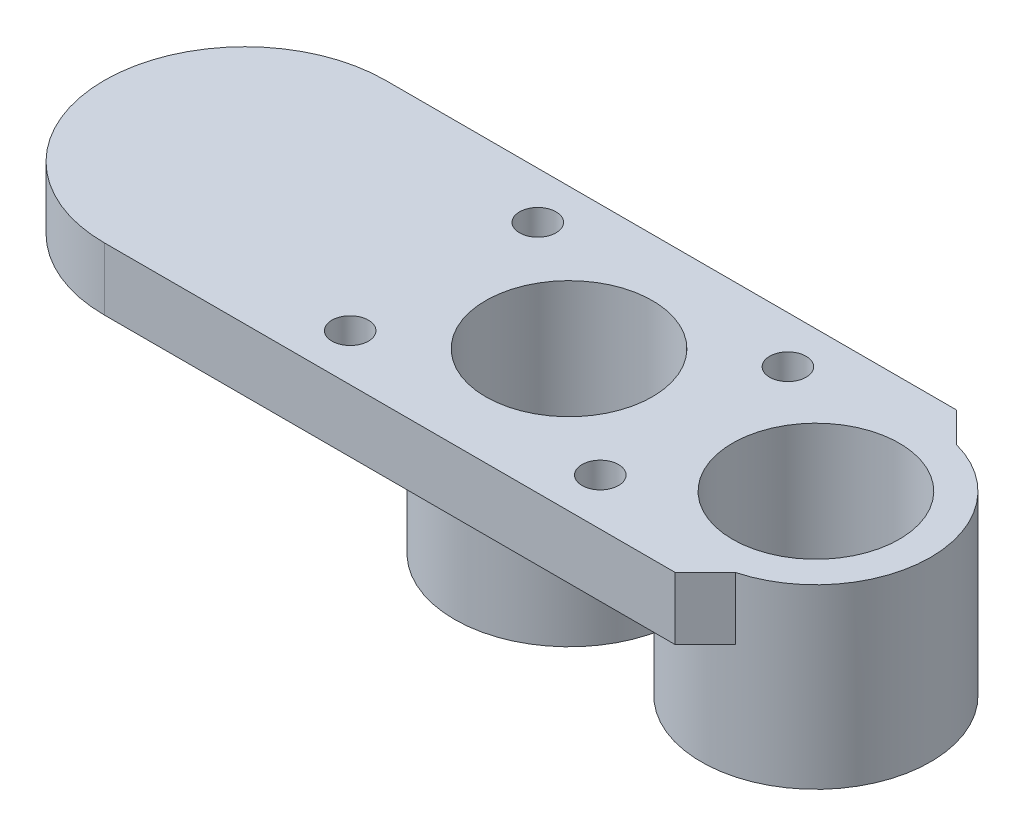
from build123d import *

# Parameters (mm, degrees)
SKETCH1_R               = 1.75
SKETCH1_R_2             = 5
BOSS_EXTRUDE1_DEPTH     = 6
SKETCH2_R               = 3
SKETCH2_R_2             = 1.75
CUT_EXTRUDE1_DEPTH      = 3
CUT_EXTRUDE2_START      = -3
SKETCH3_R               = 8
SKETCH3_R_2             = 5
CUT_EXTRUDE2_DEPTH      = 3
SKETCH5_R               = 13.5
BOSS_EXTRUDE2_DEPTH     = 6
CUT_EXTRUDE3_DEPTH      = 47.983082062
CUT_EXTRUDE3_DEPTH_BACK = 47.983082062
SKETCH6_R               = 8
BOSS_EXTRUDE6_START     = -8
SKETCH9_R               = 11
SKETCH9_R_2             = 8
BOSS_EXTRUDE6_DEPTH     = 8
BOSS_EXTRUDE7_START     = 3
SKETCH10_R              = 11
SKETCH10_R_2            = 5
BOSS_EXTRUDE7_DEPTH     = 3
CHAMFER3_SIZE           = 2.5


with BuildPart() as part:
    # Sketch1 → Boss-Extrude1 (new body)
    with BuildSketch(Plane(origin=(0, 0, 0), x_dir=(1, 0, 0), z_dir=(0, 1, 0))):
        with BuildLine():
            Line((23.69, 13.5), (-31.1, 13.5))
            Line((-31.1, 13.5), (-31.1, 10.5))
            ThreePointArc((-31.1, 10.5), (-20.6, 0), (-31.1, -10.5))
            Line((-31.1, -10.5), (-31.1, -13.5))
            Line((-31.1, -13.5), (23.69, -13.5))
            Line((23.69, -13.5), (23.69, -11))
            ThreePointArc((23.69, -11), (34.69, 0), (23.69, 11))
            Line((23.69, 11), (23.69, 13.5))
        make_face()
        with Locations(Location((-12, -9, 0), (0, 0, 270))):
            Circle(SKETCH1_R, mode=Mode.SUBTRACT)
        with Locations(Location((12, -9, 0), (0, 0, 270))):
            Circle(SKETCH1_R, mode=Mode.SUBTRACT)
        with Locations(Location((-12, 9, 0), (0, 0, 270))):
            Circle(SKETCH1_R, mode=Mode.SUBTRACT)
        with Locations(Location((0, 0, 0), (0, 0, 270))):
            Circle(SKETCH1_R_2, mode=Mode.SUBTRACT)
        with Locations(Location((12, 9, 0), (0, 0, 270))):
            Circle(SKETCH1_R, mode=Mode.SUBTRACT)
        with Locations(Location((23.69, 0, 0), (0, 0, 270))):
            Circle(SKETCH1_R_2, mode=Mode.SUBTRACT)
    extrude(amount=BOSS_EXTRUDE1_DEPTH)

    # Sketch2 → Cut-Extrude1 (cut)
    # profile 1 of 4: a face of its own
    with BuildSketch(Plane.XZ):
        with Locations(Location((-12, -9, 0), (0, 0, 270))):
            Circle(SKETCH2_R)
        with Locations(Location((-12, -9, 0), (0, 0, 270))):
            Circle(SKETCH2_R_2, mode=Mode.SUBTRACT)
    # profile 2 of 4: a face of its own
    with BuildSketch(Plane.XZ):
        with Locations(Location((-12, 9, 0), (0, 0, 270))):
            Circle(SKETCH2_R)
        with Locations(Location((-12, 9, 0), (0, 0, 270))):
            Circle(SKETCH2_R_2, mode=Mode.SUBTRACT)
    # profile 3 of 4: a face of its own
    with BuildSketch(Plane.XZ):
        with Locations(Location((12, 9, 0), (0, 0, 270))):
            Circle(SKETCH2_R)
        with Locations(Location((12, 9, 0), (0, 0, 270))):
            Circle(SKETCH2_R_2, mode=Mode.SUBTRACT)
    # profile 4 of 4: a face of its own
    with BuildSketch(Plane.XZ):
        with Locations(Location((12, -9, 0), (0, 0, 270))):
            Circle(SKETCH2_R)
        with Locations(Location((12, -9, 0), (0, 0, 270))):
            Circle(SKETCH2_R_2, mode=Mode.SUBTRACT)
    extrude(amount=-CUT_EXTRUDE1_DEPTH, mode=Mode.SUBTRACT)

    # Sketch3 → Cut-Extrude2 (cut)
    # profile 1 of 2: a face of its own
    with BuildSketch(Plane(origin=(0, 6, 0), x_dir=(1, 0, 0), z_dir=(0, 1, 0)).offset(CUT_EXTRUDE2_START)):
        with Locations(Location((0, 0, 0), (0, 0, 270))):
            Circle(SKETCH3_R)
        with Locations(Location((0, 0, 0), (0, 0, 270))):
            Circle(SKETCH3_R_2, mode=Mode.SUBTRACT)
    # profile 2 of 2: a face of its own
    with BuildSketch(Plane(origin=(0, 6, 0), x_dir=(1, 0, 0), z_dir=(0, 1, 0)).offset(CUT_EXTRUDE2_START)):
        with Locations(Location((23.69, 0, 0), (0, 0, 270))):
            Circle(SKETCH3_R)
        with Locations(Location((23.69, 0, 0), (0, 0, 270))):
            Circle(SKETCH3_R_2, mode=Mode.SUBTRACT)
    extrude(amount=CUT_EXTRUDE2_DEPTH, mode=Mode.SUBTRACT)

    # Sketch5 → Boss-Extrude2 (add)
    with BuildSketch(Plane(origin=(0, 0, 0), x_dir=(1, 0, 0), z_dir=(0, 1, 0))):
        with Locations((-31.1, 0)):
            Circle(SKETCH5_R)
    extrude(amount=BOSS_EXTRUDE2_DEPTH)

    # Sketch6 → Cut-Extrude3 (cut, two sides: drawn at the far end of the back side and taken through both)
    with BuildSketch(Plane(origin=(0, 6, 0), x_dir=(1, 0, 0), z_dir=(0, 1, 0)).offset(-CUT_EXTRUDE3_DEPTH_BACK)):
        with Locations(Location((0, 0, 0), (0, 0, 270))):
            Circle(SKETCH6_R)
        with Locations(Location((23.69, 0, 0), (0, 0, 270))):
            Circle(SKETCH6_R)
    extrude(amount=CUT_EXTRUDE3_DEPTH + CUT_EXTRUDE3_DEPTH_BACK, mode=Mode.SUBTRACT)

    # Sketch9 → Boss-Extrude6 (add)
    # profile 1 of 2: a face of its own
    with BuildSketch(Plane(origin=(0, 0, 0), x_dir=(1, 0, 0), z_dir=(0, 1, 0)).offset(BOSS_EXTRUDE6_START)):
        with Locations(Location((0, 0, 0), (0, 0, 270))):
            Circle(SKETCH9_R)
        with Locations(Location((0, 0, 0), (0, 0, 270))):
            Circle(SKETCH9_R_2, mode=Mode.SUBTRACT)
    # profile 2 of 2: a face of its own
    with BuildSketch(Plane(origin=(0, 0, 0), x_dir=(1, 0, 0), z_dir=(0, 1, 0)).offset(BOSS_EXTRUDE6_START)):
        with BuildLine():
            ThreePointArc((23.69, 11), (12.69, 0), (23.69, -11))
            ThreePointArc((23.69, -11), (31.468174593, -7.778174593), (34.69, 0))
            ThreePointArc((34.69, 0), (31.468174593, 7.778174593), (23.69, 11))
        make_face()
        with Locations(Location((23.69, 0, 0), (0, 0, 270))):
            Circle(SKETCH9_R_2, mode=Mode.SUBTRACT)
    extrude(amount=BOSS_EXTRUDE6_DEPTH)

    # Sketch10 → Boss-Extrude7 (add)
    # profile 1 of 2: a face of its own
    with BuildSketch(Plane.XZ.offset(8).offset(BOSS_EXTRUDE7_START)):
        with Locations(Location((23.69, 0, 0), (0, 0, 270))):
            Circle(SKETCH10_R)
        with Locations(Location((23.69, 0, 0), (0, 0, 270))):
            Circle(SKETCH10_R_2, mode=Mode.SUBTRACT)
    # profile 2 of 2: a face of its own
    with BuildSketch(Plane.XZ.offset(8).offset(BOSS_EXTRUDE7_START)):
        with Locations(Location((0, 0, 0), (0, 0, 90))):
            Circle(SKETCH10_R)
        with Locations(Location((0, 0, 0), (0, 0, 270))):
            Circle(SKETCH10_R_2, mode=Mode.SUBTRACT)
    extrude(amount=-BOSS_EXTRUDE7_DEPTH)

    # Chamfer3
    # the kernel refuses this chamfer: 2.5 mm, written as the material it adds along each edge
    with BuildSketch(Plane(origin=(23.69, 0, 11), x_dir=(0.9912092295509808, 0, -0.13230367815352337), z_dir=(0, 1, 0))) as chamfer3_piece_1_section:
        with BuildLine():
            Line((2.910680919, 0), (-CHAMFER3_SIZE * 0.132303678154, -CHAMFER3_SIZE * 0.991209229551))
            Line((-CHAMFER3_SIZE * 0.132303678154, -CHAMFER3_SIZE * 0.991209229551), (0, 0))
            ThreePointArc((0, 0), (1.49552658, -0.096625069), (2.910680919, 0))
        make_face()
    chamfer3_piece_1 = extrude(amount=6, mode=Mode.PRIVATE)
    chamfer3_piece_1 = split(chamfer3_piece_1, bisect_by=Plane(origin=(23.69, 0, 13.5), z_dir=(0, 0, -1)), keep=Keep.TOP, mode=Mode.PRIVATE)
    add(chamfer3_piece_1)
    with BuildSketch(Plane(origin=(23.69, 0, -11), x_dir=(0, 0, -1), z_dir=(0, 1, 0))) as chamfer3_piece_2_section:
        with BuildLine():
            Line((CHAMFER3_SIZE, 0), (-0.385093792, -2.885093792))
            ThreePointArc((-0.385093792, -2.885093792), (-0.102088007, -1.495163601), (0, 0))
            Line((0, 0), (CHAMFER3_SIZE, 0))
        make_face()
    chamfer3_piece_2 = extrude(amount=6, mode=Mode.PRIVATE)
    chamfer3_piece_2 = split(chamfer3_piece_2, bisect_by=Plane(origin=(23.69, 0, -13.5), z_dir=(0, 0, 1)), keep=Keep.TOP, mode=Mode.PRIVATE)
    add(chamfer3_piece_2)


solid = part.part
